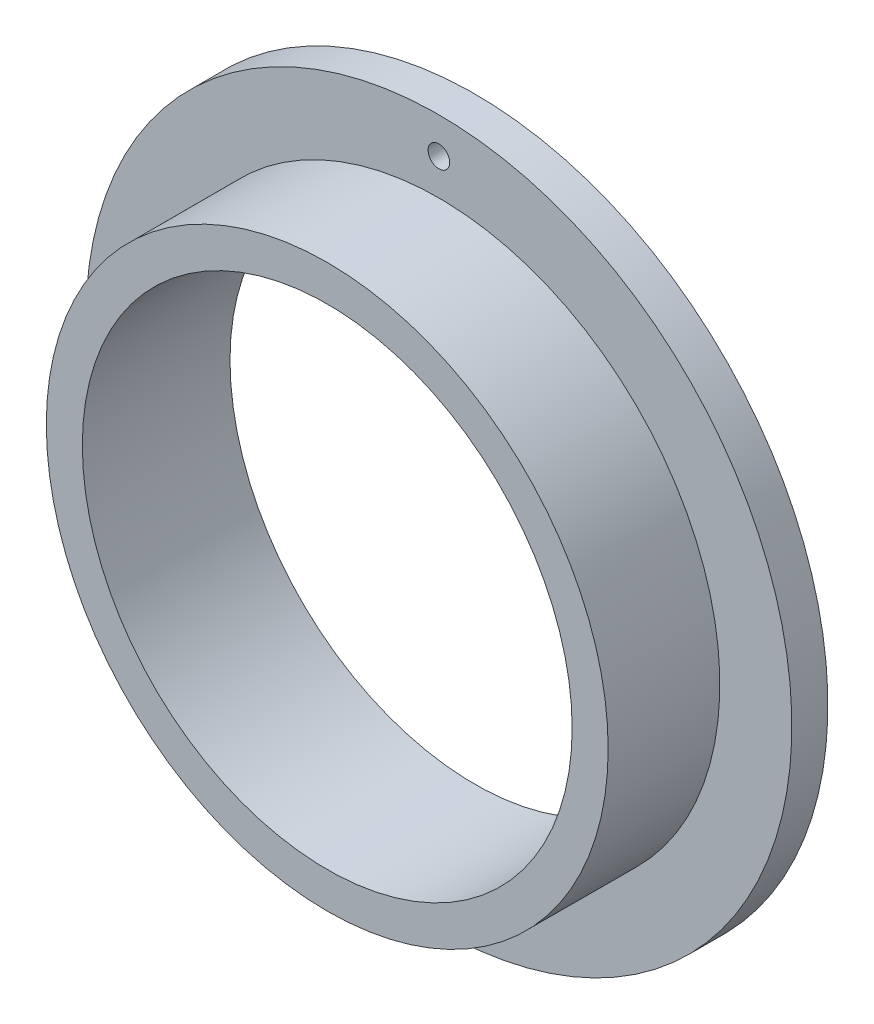
from build123d import *

# Parameters (mm, degrees)
ESQUISSE1_R             = 39
ESQUISSE1_R_2           = 34
BOSS_EXTRU_1_DEPTH      = 15.5
ESQUISSE2_R             = 49
BOSS_EXTRU_2_DEPTH      = 5
ESQUISSE3_R             = 34
ENL_V_MAT_EXTRU_1_DEPTH = 73.265136823
ESQUISSE4_R             = 1.5
ENL_V_MAT_EXTRU_2_DEPTH = 73.265136823


with BuildPart() as part:
    # Esquisse1 → Boss.-Extru.1 (new body)
    with BuildSketch(Plane.XY):
        Circle(ESQUISSE1_R)
        Circle(ESQUISSE1_R_2, mode=Mode.SUBTRACT)
    extrude(amount=BOSS_EXTRU_1_DEPTH)

    # Esquisse2 → Boss.-Extru.2 (add)
    with BuildSketch(Plane(origin=(0, 0, 0), x_dir=(-1, 0, 0), z_dir=(0, 0, -1))):
        Circle(ESQUISSE2_R)
    extrude(amount=BOSS_EXTRU_2_DEPTH)

    # Esquisse3 → Enlèv. mat.-Extru.1 (cut, through all)
    with BuildSketch(Plane(origin=(0, 0, -5), x_dir=(-1, 0, 0), z_dir=(0, 0, -1))):
        Circle(ESQUISSE3_R)
    extrude(amount=-ENL_V_MAT_EXTRU_1_DEPTH, mode=Mode.SUBTRACT)

    # Esquisse4 → Enlèv. mat.-Extru.2 (cut, through all)
    with BuildSketch(Plane(origin=(0, 0, -5), x_dir=(-1, 0, 0), z_dir=(0, 0, -1))):
        with Locations((0, 44)):
            Circle(ESQUISSE4_R)
        with Locations((0, -44)):
            Circle(ESQUISSE4_R)
    extrude(amount=-ENL_V_MAT_EXTRU_2_DEPTH, mode=Mode.SUBTRACT)


solid = part.part
